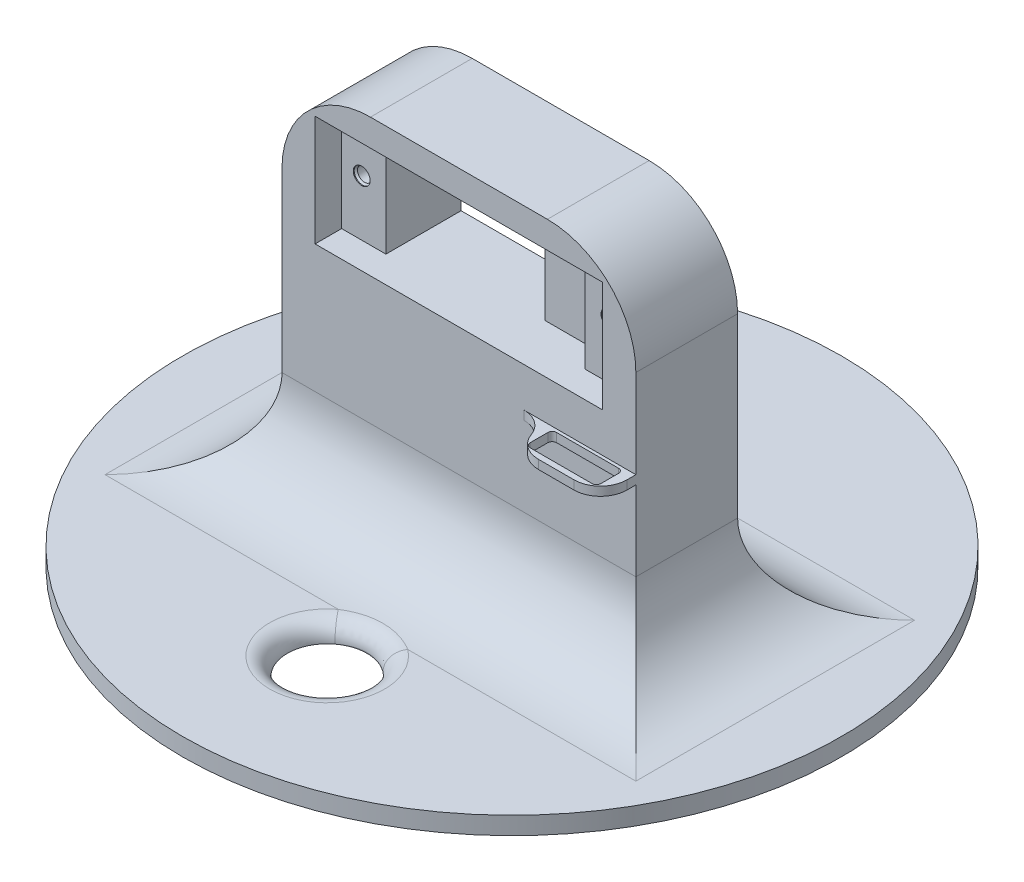
from build123d import *

# Parameters (mm, degrees)
SKETCH1_R                      = 37.25
BOSS_EXTRUDE1_DEPTH            = 2
SKETCH2_W                      = 40
SKETCH2_H                      = 12
BOSS_EXTRUDE4_DEPTH            = 40
SKETCH3_W                      = 32.5
SKETCH3_H                      = 12.5
CUT_EXTRUDE1_DEPTH             = 3
SKETCH4_W                      = 22.5
SKETCH4_H                      = 12.5
CUT_EXTRUDE2_DEPTH             = 2.5
SKETCH5_W                      = 15.5
SKETCH5_H                      = 12.5
CUT_EXTRUDE3_DEPTH             = 6
SKETCH6_W                      = 0.5
SKETCH6_H                      = 40
CUT_EXTRUDE4_DEPTH             = 81.181824624
SKETCH7_R                      = 0.95
CUT_EXTRUDE5_DEPTH             = 0.1
M2X0_4_TAPPED_HOLE1_AT_2_COUNT = 2
M2X0_4_TAPPED_HOLE1_AT_2_PITCH = 28
SKETCH11_W                     = 4
SKETCH11_H                     = 1
BOSS_EXTRUDE9_DEPTH            = 10
CUT_EXTRUDE6_REACH             = 59.089
SKETCH13_W                     = 8
SKETCH13_H                     = 3
FILLET4_R                      = 0.5
FILLET5_R                      = 3
FILLET6_R                      = 3
FILLET7_R                      = 10
FILLET8_R                      = 10
CUT_EXTRUDE7_REACH             = 68.145
SKETCH14_R                     = 4.5
FILLET10_R                     = 2


# Some blends are built 0.0001 mm under size
with BuildPart() as part:
    # Sketch1 → Boss-Extrude1 (new body)
    with BuildSketch(Plane(origin=(0, 0, 0), x_dir=(1, 0, 0), z_dir=(0, 1, 0))):
        with Locations(Location((0, 0, 0), (0, 0, 270))):
            Circle(SKETCH1_R)
    extrude(amount=BOSS_EXTRUDE1_DEPTH)

    # Sketch2 → Boss-Extrude4 (add)
    with BuildSketch(Plane(origin=(0, 2, 0), x_dir=(1, 0, 0), z_dir=(0, 1, 0))):
        Rectangle(SKETCH2_W, SKETCH2_H)
    extrude(amount=BOSS_EXTRUDE4_DEPTH)

    # Sketch3 → Cut-Extrude1 (cut)
    with BuildSketch(Plane.XY.offset(6)):
        with Locations((-0.004059612, 32.710166226)):
            Rectangle(SKETCH3_W, SKETCH3_H)
    extrude(amount=-CUT_EXTRUDE1_DEPTH, mode=Mode.SUBTRACT)

    # Sketch4 → Cut-Extrude2 (cut)
    with BuildSketch(Plane.XY.offset(3)):
        with Locations((-0.004059612, 32.710166226)):
            Rectangle(SKETCH4_W, SKETCH4_H)
    extrude(amount=-CUT_EXTRUDE2_DEPTH, mode=Mode.SUBTRACT)

    # Sketch5 → Cut-Extrude3 (cut)
    with BuildSketch(Plane.XY.offset(0.5)):
        with Locations((-3.504059612, 32.710166226)):
            Rectangle(SKETCH5_W, SKETCH5_H)
    extrude(amount=-CUT_EXTRUDE3_DEPTH, mode=Mode.SUBTRACT)

    # Sketch6 → Cut-Extrude4 (cut, through all)
    with BuildSketch(Plane(origin=(20, 0, 0), x_dir=(0, 0, -1), z_dir=(1, 0, 0))):
        with Locations((5.75, 22)):
            Rectangle(SKETCH6_W, SKETCH6_H)
    extrude(amount=-CUT_EXTRUDE4_DEPTH, mode=Mode.SUBTRACT)

    # Sketch7 → Cut-Extrude5 (cut)
    with BuildSketch(Plane.XY.offset(3)):
        with Locations((14.013948706, 32.755843114)):
            Circle(SKETCH7_R)
        with Locations((-13.986051294, 32.755843114)):
            Circle(SKETCH7_R)
    extrude(amount=-CUT_EXTRUDE5_DEPTH, mode=Mode.SUBTRACT)

    # Sketch9 → M2x0.4 Tapped Hole1 (revolve, cut)
    with BuildSketch(Plane(origin=(-13.986051294, 32.755843114, 2.9), x_dir=(0, -1, 0), z_dir=(1, 0, 0))):
        Polygon((0, 0), (0, 40.15), (0.8, 40.15), (0.8, 0.225), (1.025, 0), align=None)
    m2x0_4_tapped_hole1 = revolve(axis=Axis((-13.986051294, 32.755843114, 9.25), (0, 0, -1)), mode=Mode.SUBTRACT)

    # M2x0.4 Tapped Hole1 at 2: M2x0.4 Tapped Hole1 ×2
    with Locations(*[(i * M2X0_4_TAPPED_HOLE1_AT_2_PITCH, 0, 0) for i in range(1, M2X0_4_TAPPED_HOLE1_AT_2_COUNT)]):
        add(m2x0_4_tapped_hole1, mode=Mode.SUBTRACT)

    # Sketch11 → Boss-Extrude9 (add)
    with BuildSketch(Plane(origin=(20, 0, 0), x_dir=(0, 0, -1), z_dir=(1, 0, 0))):
        with Locations((-8, 21.5)):
            Rectangle(SKETCH11_W, SKETCH11_H)
    extrude(amount=-BOSS_EXTRUDE9_DEPTH)

    # Sketch13 → Cut-Extrude6 (cut, up to next)
    with BuildSketch(Plane(origin=(0, 22, 0), x_dir=(1, 0, 0), z_dir=(0, 1, 0)), mode=Mode.PRIVATE) as cut_extrude6_sk1:
        with Locations((14.894629289, -7.846146156)):
            Rectangle(SKETCH13_W, SKETCH13_H)
    cut_extrude6_tool1 = extrude(cut_extrude6_sk1.sketch, amount=-CUT_EXTRUDE6_REACH, mode=Mode.PRIVATE) & part.part
    add(cut_extrude6_tool1.solids().sort_by_distance((14.894629, 22, 7.846146))[0], mode=Mode.SUBTRACT)

    # Fillet4
    fillet4_edges = [part.edges().sort_by_distance(p)[0] for p in [
        (10.894629289, 21.5, 6.346146156),
        (10.894629289, 21.5, 9.346146156),
        (18.894629289, 21.5, 9.346146156),
        (18.894629289, 21.5, 6.346146156),
    ]]
    fillet(fillet4_edges, radius=FILLET4_R)

    # Fillet5
    fillet5_edges = [part.edges().sort_by_distance(p)[0] for p in [
        (10, 21.5, 10),
        (20, 21.5, 10),
    ]]
    fillet(fillet5_edges, radius=FILLET5_R)

    # Fillet6
    # the kernel refuses this fillet: 3 mm, written as the material it adds along each edge
    with BuildSketch(Plane(origin=(10, 21, 6), x_dir=(0.08547250469841872, 5.30956894242523e-15, 0.9963405296085164), z_dir=(0, 1, 0))) as fillet6_piece_1:
        with BuildLine():
            CenterArc((2.761933602, -2.903549084), FILLET6_R, 104.568024357, 70.528779366)
            Line((-0.227087987, -2.64713157), (-0.525990146, -2.621489819))
            Line((-0.525990146, -2.621489819), (-0.298902159, 0.025641751))
            Line((-0.298902159, 0.025641751), (0.025641751, 0.298902159))
            ThreePointArc((0.025641751, 0.298902159), (1.021982281, 0.213429654), (1.931887045, 0.290354908))
            Line((1.931887045, 0.290354908), (2.007345823, 0))
        make_face()
    extrude(amount=1)

    # Fillet7
    fillet7_edges = [part.edges().sort_by_distance(p)[0] for p in [
        (-20, 2, 0.25),
        (0, 2, -5.5),
        (0, 2, 6),
        (20, 2, 0.25),
    ]]
    fillet(fillet7_edges, radius=FILLET7_R)

    # Fillet8
    fillet8_edges = [part.edges().sort_by_distance(p)[0] for p in [
        (-20, 42, 0.25),
        (20, 42, 0.25),
    ]]
    fillet(fillet8_edges, radius=FILLET8_R)

    # Sketch14 → Cut-Extrude7 (cut, up to next)
    with BuildSketch(Plane(origin=(0, 2, 0), x_dir=(1, 0, 0), z_dir=(0, 1, 0)), mode=Mode.PRIVATE) as cut_extrude7_sk1:
        with Locations(Location((0.293506959, -21.181418859, 0), (0, 0, 270))):
            Circle(SKETCH14_R)
    cut_extrude7_tool1 = extrude(cut_extrude7_sk1.sketch, amount=-CUT_EXTRUDE7_REACH, mode=Mode.PRIVATE) & part.part
    add(cut_extrude7_tool1.solids().sort_by_distance((0.293507, 2, 21.181419))[0], mode=Mode.SUBTRACT)

    # Fillet10
    fillet10_edges = [part.edges().sort_by_distance(p)[0] for p in [
        (0.293506959, 2, 16.681418859),
    ]]
    fillet(fillet10_edges, radius=FILLET10_R - 0.0001)  # a hair under: the kernel refuses the full size


solid = part.part
